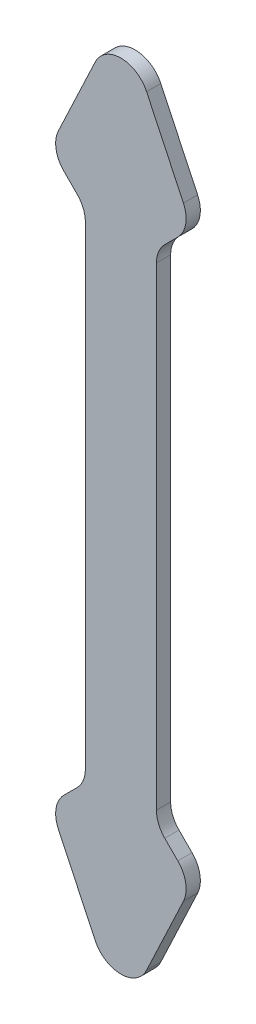
from build123d import *

# Parameters (mm, degrees)
BOSS_EXTRUDE1_DEPTH = 2


with BuildPart() as part:
    # Sketch1 → Boss-Extrude1 (new body)
    with BuildSketch(Plane.XY):
        with BuildLine():
            Line((-3.617777686, 53.531365908), (-8.799601245, 42.545043716))
            ThreePointArc((-8.799601245, 42.545043716), (-9.122569183, 40.152730346), (-8.010250683, 38.010250683))
            Line((-8.010250683, 38.010250683), (-6.171572875, 36.171572875))
            ThreePointArc((-6.171572875, 36.171572875), (-5.30448187, 34.87387948), (-5, 33.343145751))
            Line((-5, 33.343145751), (-5, -33.343145751))
            ThreePointArc((-5, -33.343145751), (-5.30448187, -34.87387948), (-6.171572875, -36.171572875))
            Line((-6.171572875, -36.171572875), (-8.010250683, -38.010250683))
            ThreePointArc((-8.010250683, -38.010250683), (-9.122569183, -40.152730346), (-8.799601245, -42.545043716))
            Line((-8.799601245, -42.545043716), (-3.617777686, -53.531365908))
            ThreePointArc((-3.617777686, -53.531365908), (0, -55.825), (3.617777686, -53.531365908))
            Line((3.617777686, -53.531365908), (8.799601245, -42.545043716))
            ThreePointArc((8.799601245, -42.545043716), (9.122569183, -40.152730346), (8.010250683, -38.010250683))
            Line((8.010250683, -38.010250683), (6.171572875, -36.171572875))
            ThreePointArc((6.171572875, -36.171572875), (5.30448187, -34.87387948), (5, -33.343145751))
            Line((5, -33.343145751), (5, 33.343145751))
            ThreePointArc((5, 33.343145751), (5.30448187, 34.87387948), (6.171572875, 36.171572875))
            Line((6.171572875, 36.171572875), (8.010250683, 38.010250683))
            ThreePointArc((8.010250683, 38.010250683), (9.122569183, 40.152730346), (8.799601245, 42.545043716))
            Line((8.799601245, 42.545043716), (3.617777686, 53.531365908))
            ThreePointArc((3.617777686, 53.531365908), (0, 55.825), (-3.617777686, 53.531365908))
        make_face()
    extrude(amount=BOSS_EXTRUDE1_DEPTH)


solid = part.part
